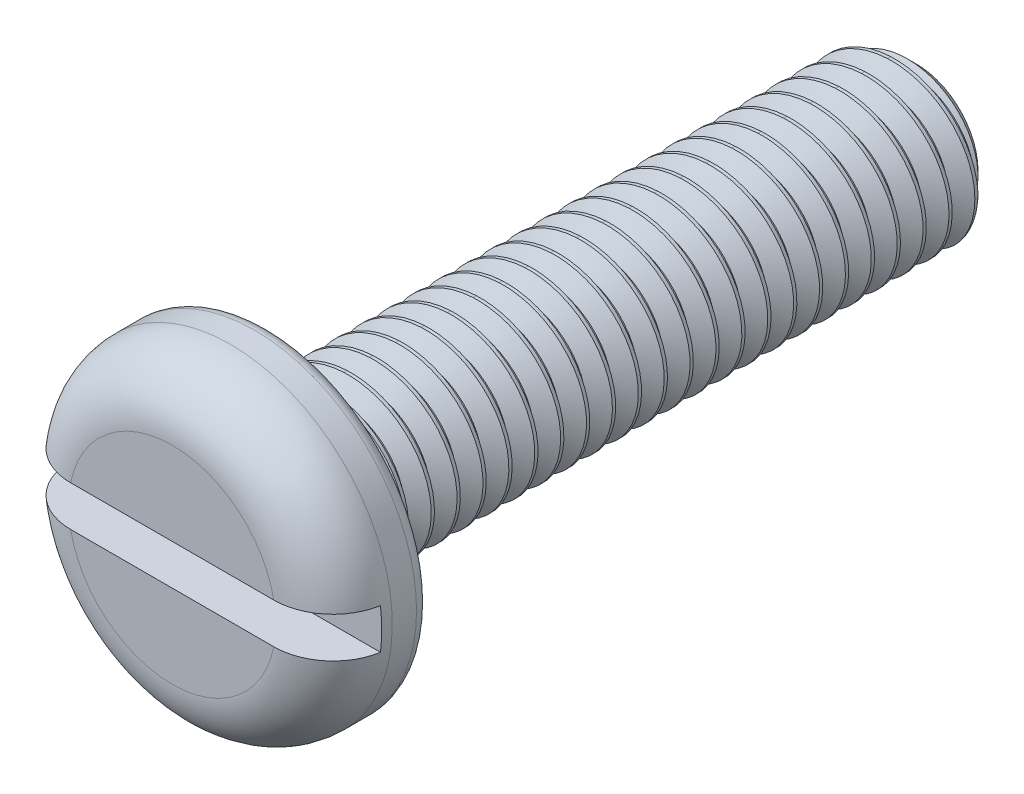
from build123d import *

# Parameters (mm, degrees)
SKETCH1_R          = 5
EXTRUDE3_DEPTH     = 3
SKETCH4_W          = 20
SKETCH4_H          = 2.5
CHAMFER1_SIZE      = 0.6
CUT_SWEEP1_PITCH   = 0.8
CUT_SWEEP1_TO      = 20
SKETCH12_W         = 10
SKETCH12_H         = 1.25
CUT_EXTRUDE1_DEPTH = 1.5
FILLET1_R          = 0.45


with BuildPart() as part:
    # Sketch1 → Extrude3 (new body)
    with BuildSketch(Plane.XY):
        Circle(SKETCH1_R)
    extrude(amount=EXTRUDE3_DEPTH)

    # Sketch11 → Cut-Revolve3 (revolve, cut)
    with BuildSketch(Plane(origin=(0, 0, 0), x_dir=(0, 0, -1), z_dir=(1, 0, 0))):
        with BuildLine():
            Line((-3, 3.2), (-3.2, 3.2))
            Line((-3.2, 3.2), (-3.2, 5.2))
            Line((-3.2, 5.2), (0, 5.2))
            Line((0, 5.2), (0, 5))
            Line((0, 5), (-1.2, 5))
            ThreePointArc((-1.2, 5), (-2.472792206, 4.472792206), (-3, 3.2))
        make_face()
    revolve(axis=Axis((0, 0, -0.441444004), (0, 0, 1)), mode=Mode.SUBTRACT)

    # Sketch12 → Cut-Extrude1 (cut)
    with BuildSketch(Plane.XY.offset(3)):
        Rectangle(SKETCH12_W, SKETCH12_H)
    extrude(amount=-CUT_EXTRUDE1_DEPTH, mode=Mode.SUBTRACT)

    # Fillet1
    fillet1_edges = [part.edges().sort_by_distance(p)[0] for p in [
        (-5, 0, 0),
    ]]
    fillet(fillet1_edges, radius=FILLET1_R)


with BuildPart() as body_2:
    # Sketch4 → Revolve1 (revolve)
    with BuildSketch(Plane(origin=(0, 0, 0), x_dir=(0, 0, -1), z_dir=(1, 0, 0)), mode=Mode.PRIVATE) as revolve1_sk:
        with Locations((10, 1.25)):
            Rectangle(SKETCH4_W, SKETCH4_H)
    revolve(revolve1_sk.sketch.rotate(Axis((0, 0, -20), (0, 0, -1)), 90), axis=Axis((0, 0, -20), (0, 0, -1)))

    # Chamfer1
    chamfer1_edges = [body_2.edges().sort_by_distance(p)[0] for p in [
        (-2.5, 0, -20),
    ]]
    chamfer(chamfer1_edges, length=CHAMFER1_SIZE)

    # Cut-Sweep1: arcs per turn and ends read off the stored shape
    # Cut-Sweep1: the profile of Sketch13 profile screwed along a right-hand helix through 26 turns, 8 arcs to a turn; built about Z, then put on its axis
    cut_sweep1_z = Axis((0, 0, 0), (0, 0, 1))
    cut_sweep1_corners = [(2.5003, 0, -0.099826795), (1.980384758, 0, -0.4), (1.980384758, 0, -0.5), (2.5003, 0, -0.800173205)]
    with BuildLine(mode=Mode.PRIVATE) as cut_sweep1_profile:
        Line(cut_sweep1_corners[0], cut_sweep1_corners[1])
        Line(cut_sweep1_corners[1], cut_sweep1_corners[2])
        Line(cut_sweep1_corners[2], cut_sweep1_corners[3])
        Line(cut_sweep1_corners[3], cut_sweep1_corners[0])
    cut_sweep1_cap = Face(cut_sweep1_profile.wire())
    cut_sweep1_turn_angles = [0, 22.5, 45, 67.5, 90, 112.5, 135, 157.5, 180, 202.5, 225, 247.5, 270, 292.5, 315, 337.5, 360]
    cut_sweep1_turn_weights = [1, 0.9238795325112867, 1, 0.9238795325112867, 1, 0.9238795325112867, 1, 0.9238795325112867, 1, 0.9238795325112867, 1, 0.9238795325112867, 1, 0.9238795325112867, 1, 0.9238795325112867, 1]
    cut_sweep1_turn_rails = [Edge.make_bspline([Vector(p[0], p[1], 0).rotate(cut_sweep1_z, cut_sweep1_turn_angles[k]) / cut_sweep1_turn_weights[k] + Vector(0, 0, p[2] + CUT_SWEEP1_PITCH * cut_sweep1_turn_angles[k] / 360) for k in range(17)], [0, 0, 0, 1, 1, 2, 2, 3, 3, 4, 4, 5, 5, 6, 6, 7, 7, 8, 8, 8], 2, cut_sweep1_turn_weights) for p in cut_sweep1_corners]
    cut_sweep1_turn_sides = [Face.make_surface_from_curves(cut_sweep1_turn_rails[p[0]], cut_sweep1_turn_rails[p[1]]) for p in [(0, 1), (1, 2), (2, 3), (3, 0)]]
    cut_sweep1 = Plane(origin=(0, 0, -20), x_dir=(0.7071067811865512, 0.7071067811865438, 0), z_dir=(0, 0, 1)) * split(Solid(Shell([*[p.moved(Location((0, 0, CUT_SWEEP1_PITCH * i))) for i in range(26) for p in cut_sweep1_turn_sides], cut_sweep1_cap, cut_sweep1_cap.rotate(cut_sweep1_z, 9360).moved(Location((0, 0, CUT_SWEEP1_PITCH * 9360 / 360)))])), bisect_by=Plane.XY.offset(CUT_SWEEP1_TO), keep=Keep.BOTTOM, mode=Mode.PRIVATE)
    add(cut_sweep1, mode=Mode.SUBTRACT)


solid = Compound([part.part, body_2.part])
